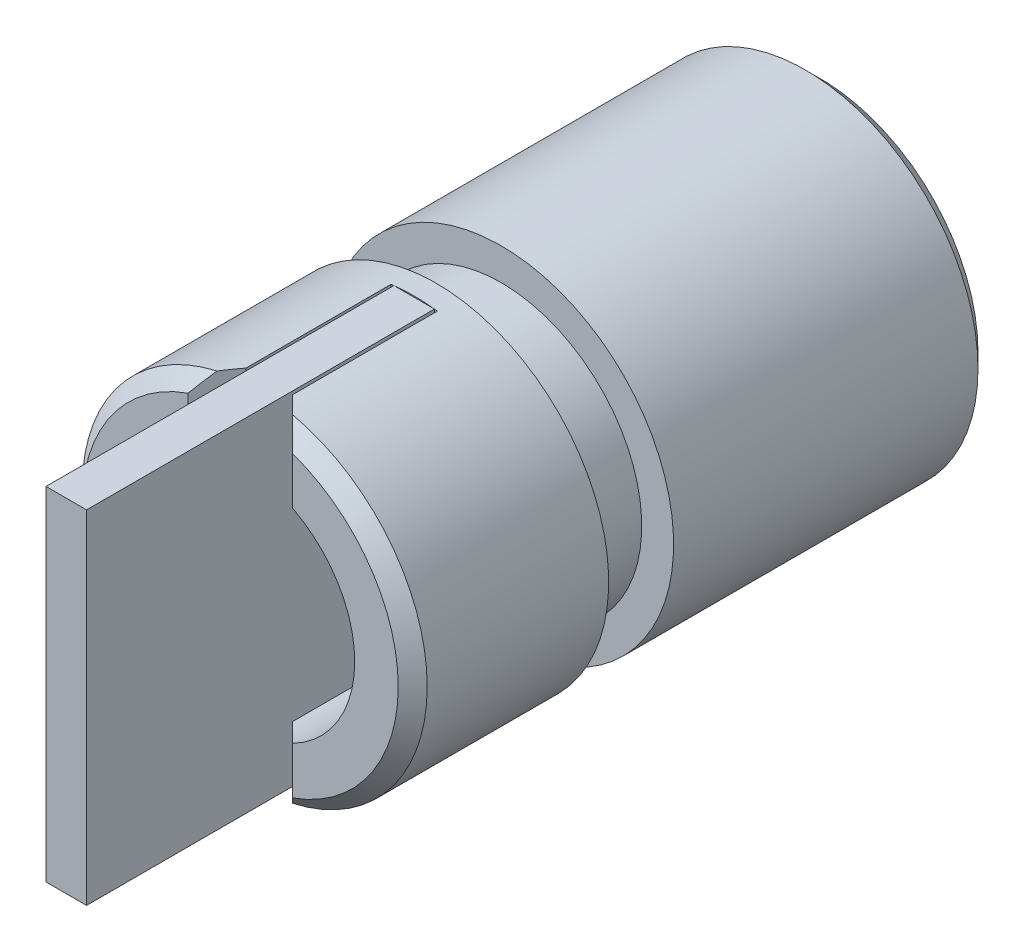
from build123d import *

# Parameters (mm, degrees)
ESBO_O1_R                = 2.975
RESSALTO_EXTRUS_O1_DEPTH = 10
ESBO_O2_R                = 4.073112834
ESBO_O2_R_2              = 2.425
CORTE_EXTRUS_O1_DEPTH    = 1.12
ESBO_O3_R                = 1.455
CORTE_EXTRUS_O2_DEPTH    = 1
ESBO_O4_R                = 1.975
CORTE_EXTRUS_O3_DEPTH    = 9
RESSALTO_EXTRUS_O2_START = 0.5
ESBO_O5_R                = 1.975
RESSALTO_EXTRUS_O2_DEPTH = 0.5
CHANFRO1_SIZE            = 0.25
ESBO_O6_W                = 0.8
ESBO_O6_H                = 6.683609012
CORTE_EXTRUS_O4_DEPTH    = 3
CHANFRO2_SIZE            = 0.5
ESBO_O7_W                = 0.7
ESBO_O7_H                = 5.908680056
RESSALTO_EXTRUS_O3_DEPTH = 6


with BuildPart() as part:
    # Esboço1 → Ressalto-extrusão1 (new body)
    with BuildSketch(Plane.XY):
        Circle(ESBO_O1_R)
    extrude(amount=RESSALTO_EXTRUS_O1_DEPTH)

    # Esboço2 → Corte-extrusão1 (cut)
    with BuildSketch(Plane(origin=(0, 0, 5.5), x_dir=(-1, 0, 0), z_dir=(0, 0, -1))):
        Circle(ESBO_O2_R)
        Circle(ESBO_O2_R_2, mode=Mode.SUBTRACT)
    extrude(amount=-CORTE_EXTRUS_O1_DEPTH, mode=Mode.SUBTRACT)

    # Esboço3 → Corte-extrusão2 (cut)
    with BuildSketch(Plane(origin=(0, 0, 0), x_dir=(-1, 0, 0), z_dir=(0, 0, -1))):
        Circle(ESBO_O3_R)
    extrude(amount=-CORTE_EXTRUS_O2_DEPTH, mode=Mode.SUBTRACT)

    # Esboço4 → Corte-extrusão3 (cut)
    with BuildSketch(Plane.XY.offset(10)):
        Circle(ESBO_O4_R)
    extrude(amount=-CORTE_EXTRUS_O3_DEPTH, mode=Mode.SUBTRACT)

    # Esboço5 → Ressalto-extrusão2 (add)
    with BuildSketch(Plane.XY.offset(1).offset(RESSALTO_EXTRUS_O2_START)):
        Circle(ESBO_O5_R)
    extrude(amount=-RESSALTO_EXTRUS_O2_DEPTH)

    # Chanfro1
    chanfro1_edges = [part.edges().sort_by_distance(p)[0] for p in [
        (-2.975, 0, 0),
        (-2.975, 0, 10),
    ]]
    chamfer(chanfro1_edges, length=CHANFRO1_SIZE)

    # Esboço6 → Corte-extrusão4 (cut)
    with BuildSketch(Plane.XY.offset(10)):
        Rectangle(ESBO_O6_W, ESBO_O6_H)
    extrude(amount=-CORTE_EXTRUS_O4_DEPTH, mode=Mode.SUBTRACT)

    # Chanfro2
    # the kernel refuses this chamfer: 0.5 mm, written as the material it takes off along each edge
    with BuildSketch(Plane(origin=(0.4, 0.64822805, 10), x_dir=(-0.027495876610586403, 0, -0.9996219169112968), z_dir=(0, 1, 0))) as chanfro2_piece_1:
        Polygon((CHANFRO2_SIZE * 0.999621916911, -CHANFRO2_SIZE * 0.0274958766106), (-CHANFRO2_SIZE * 0.0274958766106, -CHANFRO2_SIZE * 0.999621916911), (0, 0), align=None)
    extrude(amount=3.333095776, mode=Mode.SUBTRACT)
    with BuildSketch(Plane(origin=(0.4, -3.981323826, 10), x_dir=(0.9996219169112968, 0, 0.027495876610585633), z_dir=(0, 1, 0)), Plane(origin=(-0.4, -0.64822805, 10), x_dir=(-0.9996219169112968, 0, 0.027495876610585623), z_dir=(0, -1, 0)), Plane(origin=(-0.4, 3.981323826, 10), x_dir=(-0.9996219169112968, 0, 0.027495876610585623), z_dir=(0, -1, 0))) as chanfro2_piece_2:
        Polygon((CHANFRO2_SIZE * 0.999621916911, CHANFRO2_SIZE * 0.0274958766106), (-CHANFRO2_SIZE * 0.0274958766106, CHANFRO2_SIZE * 0.999621916911), (0, 0), align=None)
    extrude(amount=3.333095776, mode=Mode.SUBTRACT)

    # Esboço7 → Ressalto-extrusão3 (add)
    with BuildSketch(Plane.XY.offset(7)):
        Rectangle(ESBO_O7_W, ESBO_O7_H)
    extrude(amount=RESSALTO_EXTRUS_O3_DEPTH)


solid = part.part
